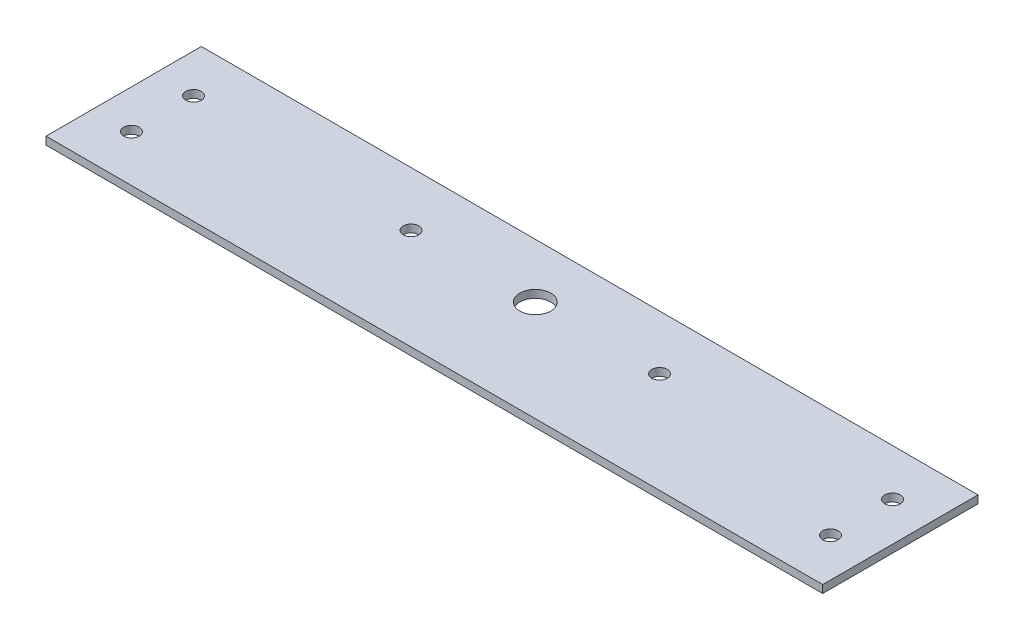
from build123d import *

# Parameters (mm, degrees)
SKETCH1_W           = 500
SKETCH1_H           = 100
BOSS_EXTRUDE1_DEPTH = 5
SKETCH3_R           = 10
CUT_EXTRUDE1_DEPTH  = 510.926465287
SKETCH4_R           = 5
CUT_EXTRUDE2_DEPTH  = 510.926465287
SKETCH5_R           = 5
CUT_EXTRUDE3_DEPTH  = 510.926465287
SKETCH7_R           = 5
CUT_EXTRUDE4_DEPTH  = 510.926465287


with BuildPart() as part:
    # Sketch1 → Boss-Extrude1 (new body)
    with BuildSketch(Plane(origin=(0, 0, 0), x_dir=(1, 0, 0), z_dir=(0, 1, 0))):
        with Locations((250, 50)):
            Rectangle(SKETCH1_W, SKETCH1_H)
    extrude(amount=BOSS_EXTRUDE1_DEPTH)

    # Sketch3 → Cut-Extrude1 (cut, through all)
    with BuildSketch(Plane(origin=(0, 5, 0), x_dir=(1, 0, 0), z_dir=(0, 1, 0))):
        with Locations((250, 65)):
            Circle(SKETCH3_R)
    extrude(amount=-CUT_EXTRUDE1_DEPTH, mode=Mode.SUBTRACT)

    # Sketch4 → Cut-Extrude2 (cut, through all)
    with BuildSketch(Plane(origin=(0, 5, 0), x_dir=(1, 0, 0), z_dir=(0, 1, 0))):
        with Locations((170, 65)):
            Circle(SKETCH4_R)
    extrude(amount=-CUT_EXTRUDE2_DEPTH, mode=Mode.SUBTRACT)

    # Sketch5 → Cut-Extrude3 (cut, through all)
    with BuildSketch(Plane(origin=(0, 5, 0), x_dir=(1, 0, 0), z_dir=(0, 1, 0))):
        with Locations((330, 65)):
            Circle(SKETCH5_R)
    extrude(amount=-CUT_EXTRUDE3_DEPTH, mode=Mode.SUBTRACT)

    # Sketch7 → Cut-Extrude4 (cut, through all)
    with BuildSketch(Plane(origin=(0, 0, 0), x_dir=(-1, 0, 0), z_dir=(0, -1, 0))):
        with Locations((-475, 70)):
            Circle(SKETCH7_R)
        with Locations((-475, 30)):
            Circle(SKETCH7_R)
        with Locations((-25, 30)):
            Circle(SKETCH7_R)
        with Locations((-25, 70)):
            Circle(SKETCH7_R)
    extrude(amount=-CUT_EXTRUDE4_DEPTH, mode=Mode.SUBTRACT)


solid = part.part
